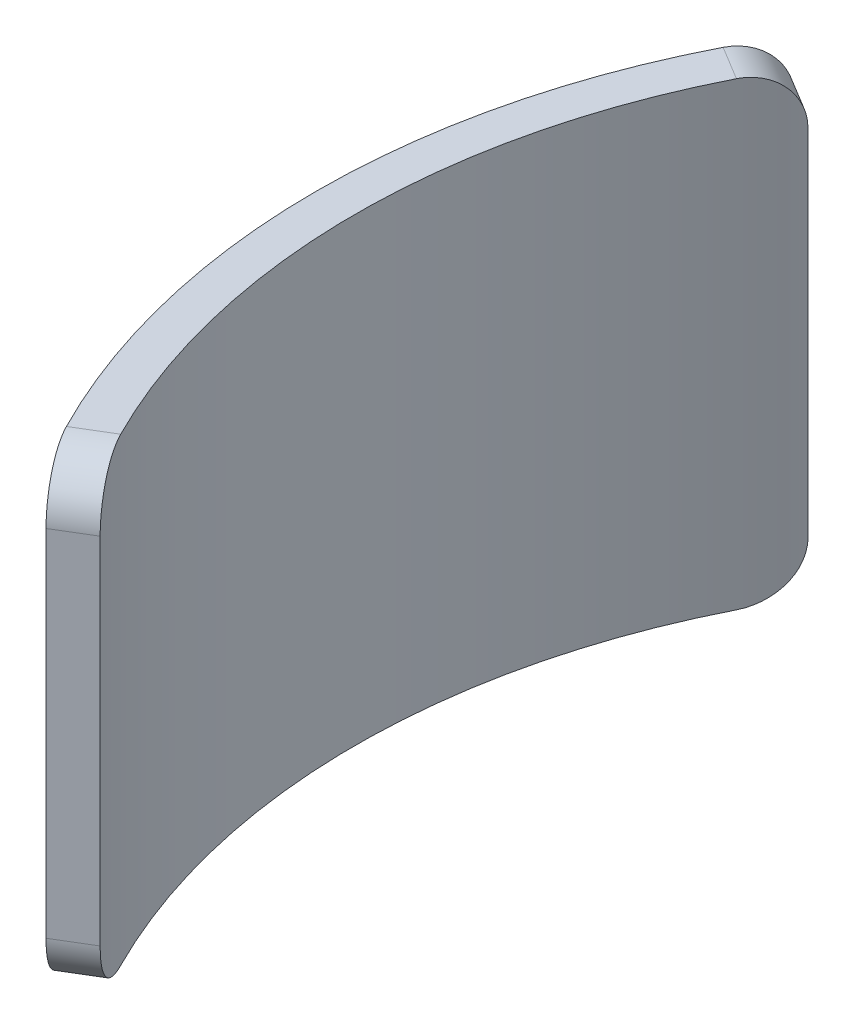
from build123d import *

# Parameters (mm, degrees)
BOSS_EXTRUDE1_DEPTH = 35
FILLET2_R           = 4


with BuildPart() as part:
    # Sketch1 → Boss-Extrude1 (new body)
    with BuildSketch(Plane(origin=(0, 0, 0), x_dir=(1, 0, 0), z_dir=(0, 1, 0))):
        with BuildLine():
            ThreePointArc((-47.800398958, -20.472465885), (-52, 0), (-47.800398958, 20.472465885))
            ThreePointArc((-47.800398958, 20.472465885), (-46.25587256, 23.756983262), (-44.4859922, 26.925759005))
            Line((-44.4859922, 26.925759005), (-47.05249175, 28.479168178))
            ThreePointArc((-47.05249175, 28.479168178), (-55, 0), (-47.05249175, -28.479168178))
            Line((-47.05249175, -28.479168178), (-44.4859922, -26.925759005))
            ThreePointArc((-44.4859922, -26.925759005), (-46.25587256, -23.756983262), (-47.800398958, -20.472465885))
        make_face()
    extrude(amount=BOSS_EXTRUDE1_DEPTH)

    # Fillet2
    fillet2_edges = [part.edges().sort_by_distance(p)[0] for p in [
        (-45.769241975, 35, -27.702463591),
        (-45.769241975, 0, -27.702463591),
        (-45.769241975, 35, 27.702463591),
        (-45.769241975, 0, 27.702463591),
    ]]
    fillet(fillet2_edges, radius=FILLET2_R)


solid = part.part
